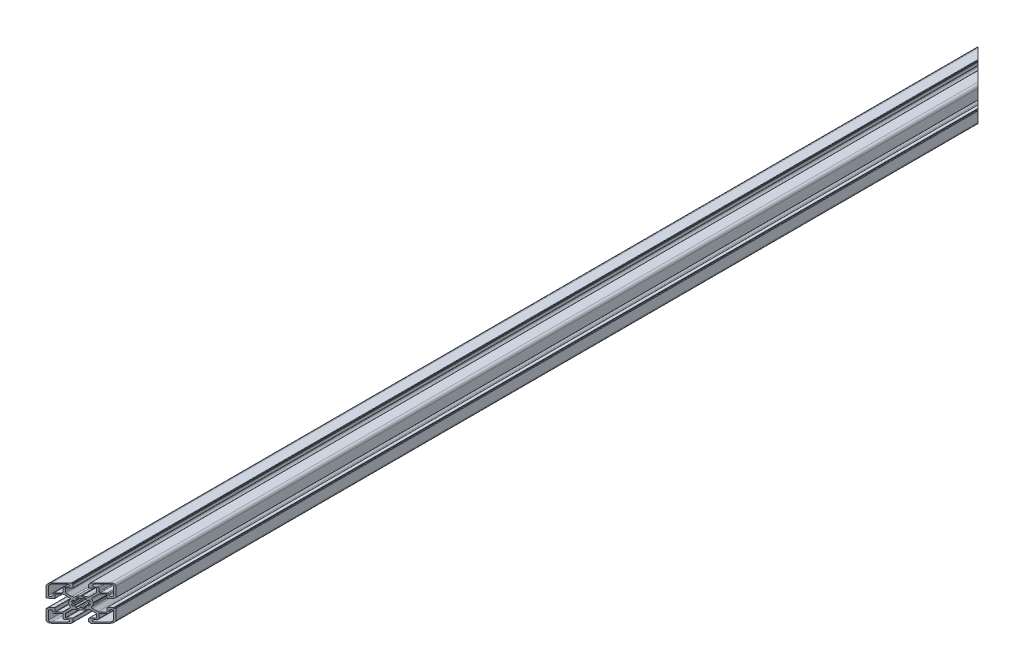
from build123d import *

# Parameters (mm, degrees)
BOSS_EXTRUDE1_DEPTH      = 1524
FILLET4_R                = 1.885
FILLET5_R                = 0.377
DELETEFACE1_START        = -1524
DELETEFACE1_DEPTH        = 3048
CUT_EXTRUDE1_START       = -1524
CUT_EXTRUDE1_DEPTH       = 3048
CIRPATTERN2_COUNT        = 3
CIRPATTERN2_ANGLE        = 180
FILLET2_R                = 0.377
FILLET3_R                = 0.1885
CUT_EXTRUDE2_START       = -3048
SKETCH5_R                = 6.375
CUT_EXTRUDE2_DEPTH       = 3048
BOSS_EXTRUDE2_DEPTH      = 1524
FILLET6_R                = 0.377
CIRPATTERN1_COUNT        = 8
FILLET6_OF_CIRPATTERN1_R = 0.377
CUT_EXTRUDE3_DEPTH       = 1525.332148844
CUT_EXTRUDE3_DEPTH_BACK  = 1525.332148844
SKETCH8_W                = 45
SKETCH8_H                = 45
CUT_EXTRUDE4_DEPTH       = 1848
CUT_EXTRUDE5_DEPTH       = 1848
CUT_EXTRUDE6_DEPTH       = 1848


# Read off the part's stored shape, not the designer's step: DeleteFace1
with BuildPart() as part:
    # Sketch3 → Boss-Extrude1 (new, symmetric)
    with BuildSketch(Plane.XY):
        with BuildLine():
            Line((0, -8), (0, -5))
            ThreePointArc((0, -5), (3.535533906, -3.535533906), (5, 0))
            Line((5, 0), (8, 0))
            ThreePointArc((8, 0), (7.57237156, -2.58054044), (6.335202759, -4.885202759))
            Line((6.335202759, -4.885202759), (11.5, -10.05))
            Line((11.5, -10.05), (16.7, -10.05))
            Line((16.7, -10.05), (16.7, -5))
            Line((16.7, -5), (21.05, -5))
            Line((21.05, -5), (21.05, 0))
            Line((21.05, 0), (22.5, 0))
            Line((22.5, 0), (22.5, -18.875))
            ThreePointArc((22.5, -18.875), (21.438262082, -21.438262082), (18.875, -22.5))
            Line((18.875, -22.5), (0, -22.5))
            Line((0, -22.5), (0, -21.05))
            Line((0, -21.05), (5, -21.05))
            Line((5, -21.05), (5, -16.7))
            Line((5, -16.7), (10.05, -16.7))
            Line((10.05, -16.7), (10.05, -11.5))
            Line((10.05, -11.5), (4.885202759, -6.335202759))
            ThreePointArc((4.885202759, -6.335202759), (2.58054044, -7.57237156), (0, -8))
        make_face()
        with BuildLine():
            Line((18.15, -8.79375), (18.15, -10.5575))
            ThreePointArc((18.15, -10.5575), (17.873948141, -11.223948141), (17.2075, -11.5))
            Line((17.2075, -11.5), (12.4425, -11.5))
            ThreePointArc((12.4425, -11.5), (11.776051859, -11.776051859), (11.5, -12.4425))
            Line((11.5, -12.4425), (11.5, -17.2075))
            ThreePointArc((11.5, -17.2075), (11.223948141, -17.873948141), (10.5575, -18.15))
            Line((10.5575, -18.15), (8.79375, -18.15))
            ThreePointArc((8.79375, -18.15), (7.34375, -19.6), (8.79375, -21.05))
            Line((8.79375, -21.05), (18.875, -21.05))
            ThreePointArc((18.875, -21.05), (20.412957249, -20.412957249), (21.05, -18.875))
            Line((21.05, -18.875), (21.05, -8.79375))
            ThreePointArc((21.05, -8.79375), (19.6, -7.34375), (18.15, -8.79375))
        make_face(mode=Mode.SUBTRACT)
    extrude(amount=BOSS_EXTRUDE1_DEPTH, both=True)

    # Fillet4
    fillet4_edges = [part.edges().sort_by_distance(p)[0] for p in [
        (10.05, -11.5, 0),
        (4.885202759, -6.335202759, 0),
        (6.335202759, -4.885202759, 0),
        (11.5, -10.05, 0),
    ]]
    fillet(fillet4_edges, radius=FILLET4_R)

    # Fillet5
    fillet5_edges = [part.edges().sort_by_distance(p)[0] for p in [
        (5, -21.05, 0),
        (5, -16.7, 0),
        (10.05, -16.7, 0),
        (16.7, -10.05, 0),
        (16.7, -5, 0),
        (21.05, -5, 0),
    ]]
    fillet(fillet5_edges, radius=FILLET5_R)

    # Mirror1: part across plane


with BuildPart() as part_1:
    add(part.part)
    add(part.part.mirror(Plane.ZX))

    # DeleteFace1 outline → DeleteFace1 (cut)
    with BuildSketch(Plane.XY.offset(DELETEFACE1_START)):
        with BuildLine():
            ThreePointArc((4.623, 21.05), (4.889579257, 20.939579257), (5, 20.673))
            Line((5, 20.673), (5, 21.05))
            Line((5, 21.05), (4.623, 21.05))
        make_face()
    extrude(amount=DELETEFACE1_DEPTH, mode=Mode.SUBTRACT)

    # Sketch4 → Cut-Extrude1 (cut)
    with BuildSketch(Plane.XY.offset(CUT_EXTRUDE1_START)):
        Polygon((5.85, 21.05), (5.85, 22.5), (0, 22.5), (-5.85, 22.5), (-5.85, 21.05), (-5, 21.05), (-5, 16.7), (5, 16.7), (5, 21.05), align=None)
    cut_extrude1 = extrude(amount=CUT_EXTRUDE1_DEPTH, mode=Mode.SUBTRACT)

    # CirPattern2: Cut-Extrude1 ×3 about axis
    cirpattern2_axis = Axis((0, 0, 1489), (0, 0, -1))
    for i in range(1, CIRPATTERN2_COUNT):
        add(cut_extrude1.rotate(cirpattern2_axis, i * CIRPATTERN2_ANGLE / (CIRPATTERN2_COUNT - 1)), mode=Mode.SUBTRACT)

    # Fillet2
    fillet2_edges = [part_1.edges().sort_by_distance(p)[0] for p in [
        (5.85, 22.5, 0),
        (22.5, 5.85, 0),
        (22.5, -5.85, 0),
        (5.85, -22.5, 0),
    ]]
    fillet(fillet2_edges, radius=FILLET2_R)

    # Fillet3
    fillet3_edges = [part_1.edges().sort_by_distance(p)[0] for p in [
        (5, 21.05, 0),
        (5.85, 21.05, 0),
        (21.05, -5, 0),
        (21.05, -5.85, 0),
        (21.05, 5, 0),
        (21.05, 5.85, 0),
        (5, -21.05, 0),
        (5.85, -21.05, 0),
    ]]
    fillet(fillet3_edges, radius=FILLET3_R)

    # Mirror2: part across plane


with BuildPart() as part_2:
    add(part_1.part)
    add(part_1.part.mirror(Plane(origin=(0, 0, 0), x_dir=(0, 0, 1), z_dir=(1, 0, 0))))

    # Sketch5 → Cut-Extrude2 (cut)
    with BuildSketch(Plane.XY.offset(1524).offset(CUT_EXTRUDE2_START)):
        Circle(SKETCH5_R)
        Polygon((-0.580185128, 8), (0.580185128, 8), (0, 7.59375), align=None)
        Polygon((-8, 0.580185128), (-8, -0.580185128), (-7.59375, 0), align=None)
        Polygon((8, 0.580185128), (8, -0.580185128), (7.59375, 0), align=None)
        Polygon((-0.580185128, -8), (0.580185128, -8), (0, -7.59375), align=None)
    extrude(amount=CUT_EXTRUDE2_DEPTH, mode=Mode.SUBTRACT)

    # Sketch6 → Boss-Extrude2 (add, symmetric)
    with BuildSketch(Plane.XY):
        with BuildLine():
            Line((-0.97545161, -4.903926402), (-1.243700803, -6.252506163))
            ThreePointArc((-1.243700803, -6.252506163), (0, -6.375), (1.243700803, -6.252506163))
            Line((1.243700803, -6.252506163), (0.97545161, -4.903926402))
            ThreePointArc((0.97545161, -4.903926402), (0, -5), (-0.97545161, -4.903926402))
        make_face()
    boss_extrude2 = extrude(amount=BOSS_EXTRUDE2_DEPTH, both=True)

    # Fillet6
    fillet6_edges = [part_2.edges().sort_by_distance(p)[0] for p in [
        (-1.243700803, -6.252506163, 0),
        (1.243700803, -6.252506163, 0),
    ]]
    fillet(fillet6_edges, radius=FILLET6_R)

    # CirPattern1: Boss-Extrude2 ×8 about axis
    cirpattern1_axis = Axis((0, 0, 0), (0, 0, 1))
    for i in range(1, CIRPATTERN1_COUNT):
        add(boss_extrude2.rotate(cirpattern1_axis, i * 360 / CIRPATTERN1_COUNT))

    # Fillet6 of CirPattern1
    fillet6_of_cirpattern1_edges = [part_2.edges().sort_by_distance(p)[0] for p in [
        (3.541760235, -5.300618778, 0),
        (5.300618778, -3.541760235, 0),
        (6.252506163, -1.243700803, 0),
        (6.252506163, 1.243700803, 0),
        (5.300618778, 3.541760235, 0),
        (3.541760235, 5.300618778, 0),
        (1.243700803, 6.252506163, 0),
        (-1.243700803, 6.252506163, 0),
        (-3.541760235, 5.300618778, 0),
        (-5.300618778, 3.541760235, 0),
        (-6.252506163, 1.243700803, 0),
        (-6.252506163, -1.243700803, 0),
        (-5.300618778, -3.541760235, 0),
        (-3.541760235, -5.300618778, 0),
    ]]
    fillet(fillet6_of_cirpattern1_edges, radius=FILLET6_OF_CIRPATTERN1_R)

    # Sketch7 → Cut-Extrude3 (cut, two sides: drawn at the far end of the back side and taken through both)
    with BuildSketch(Plane.XY.offset(-CUT_EXTRUDE3_DEPTH_BACK)):
        Polygon((-7.031875, 16.7), (-6.596875, 17.135), (-6.161875, 16.7), align=None)
    extrude(amount=CUT_EXTRUDE3_DEPTH + CUT_EXTRUDE3_DEPTH_BACK, mode=Mode.SUBTRACT)

    # Sketch8 → Cut-Extrude4 (cut)
    with BuildSketch(Plane.XY.offset(1524)):
        Rectangle(SKETCH8_W, SKETCH8_H)
    extrude(amount=-CUT_EXTRUDE4_DEPTH, mode=Mode.SUBTRACT)

    # Sketch9 → Cut-Extrude5 (cut)
    with BuildSketch(Plane(origin=(0, 22.5, 0), x_dir=(1, 0, 0), z_dir=(0, 1, 0))):
        Polygon((-22.5, 324), (22.5, 369), (22.5, 324), align=None)
    extrude(amount=-CUT_EXTRUDE5_DEPTH, mode=Mode.SUBTRACT)

    # Sketch10 → Cut-Extrude6 (cut)
    with BuildSketch(Plane(origin=(0, 22.5, 0), x_dir=(1, 0, 0), z_dir=(0, 1, 0))):
        Polygon((-22.5, 1524), (22.5, 1479), (22.5, 1524), align=None)
    extrude(amount=-CUT_EXTRUDE6_DEPTH, mode=Mode.SUBTRACT)


solid = part_2.part
